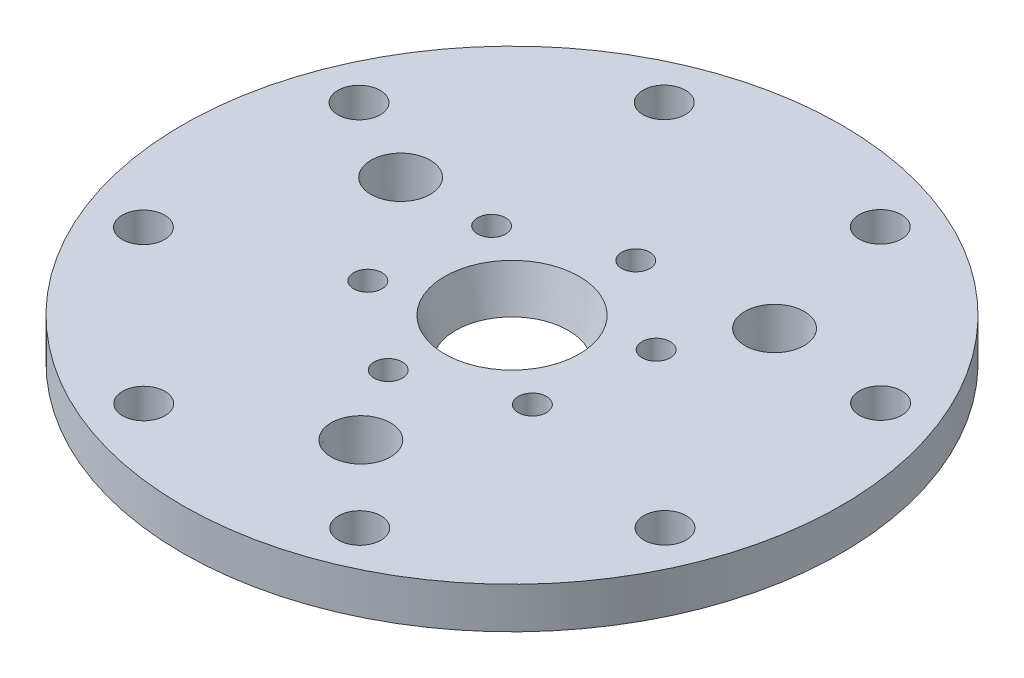
from build123d import *

# Parameters (mm, degrees)
SKETCH1_R               = 76.2
BOSS_EXTRUDE1_DEPTH     = 9.525
CIRPATTERN6_COUNT       = 3
F_3_8_CLEARANCE_HOLE1_D = 9.8044
F_1_4_CLEARANCE_HOLE1_D = 6.5278


with BuildPart() as part:
    # Sketch1 → Boss-Extrude1 (new body)
    with BuildSketch(Plane(origin=(0, 0, 0), x_dir=(1, 0, 0), z_dir=(0, 1, 0))):
        Circle(SKETCH1_R)
    extrude(amount=BOSS_EXTRUDE1_DEPTH)

    # Sketch5 → Cut-Revolve1 (revolve, cut)
    with BuildSketch(Plane.XY):
        Polygon((0, 0), (0, 9.525), (15.552216058, 9.525), (13, 0), align=None)
    revolve(axis=Axis((0, 0, 0), (0, 1, 0)), mode=Mode.SUBTRACT)

    # Sketch15 → 1/4 NPT Tapped Hole1 (revolve, cut)
    with BuildSketch(Plane(origin=(33.011727721, 9.525, -27.700128555), x_dir=(0, 0, 1), z_dir=(1, 0, 0))):
        Polygon((0, 0), (0, 9.525), (5.5626, 9.525), (5.5626, 10.0203), (6.557978799, 10.0203), (6.858, 0), align=None)
    f_1_4_npt_tapped_hole1 = revolve(axis=Axis((33.011727721, 15.875, -27.700128555), (0, -1, 0)), mode=Mode.SUBTRACT)

    # CirPattern6: 1/4 NPT Tapped Hole1 ×3 about axis
    cirpattern6_axis = Axis((0, 9.525, 0), (0, 1, 0))
    for i in range(1, CIRPATTERN6_COUNT):
        add(f_1_4_npt_tapped_hole1.rotate(cirpattern6_axis, i * 360 / CIRPATTERN6_COUNT), mode=Mode.SUBTRACT)

    # 3/8 Clearance Hole1 (through all)
    with Locations(Plane(origin=(0, 9.525, 0), x_dir=(1, 0, 0), z_dir=(0, 1, 0))):
        with Locations((60.207217661, 25.013604371), (60.257374801, -24.888494705), (24.885638551, 60.264250563), (-25.016460514, 60.214093421), (-60.267106699, 24.892514335), (-60.216949569, -25.009584719), (-24.895370482, -60.260230921), (25.006728592, -60.210073801)):
            Hole(F_3_8_CLEARANCE_HOLE1_D / 2)

    # 1/4 Clearance Hole1 (through all)
    with Locations(Plane(origin=(0, 9.525, 0), x_dir=(1, 0, 0), z_dir=(0, 1, 0))):
        with Locations((3.330049479, 25.294237026), (-20.240427094, 15.531025958), (20.240427094, -15.531025958), (-23.570476573, -9.763211068), (-3.330049479, -25.294237026), (23.570476573, 9.763211068)):
            Hole(F_1_4_CLEARANCE_HOLE1_D / 2)


solid = part.part
